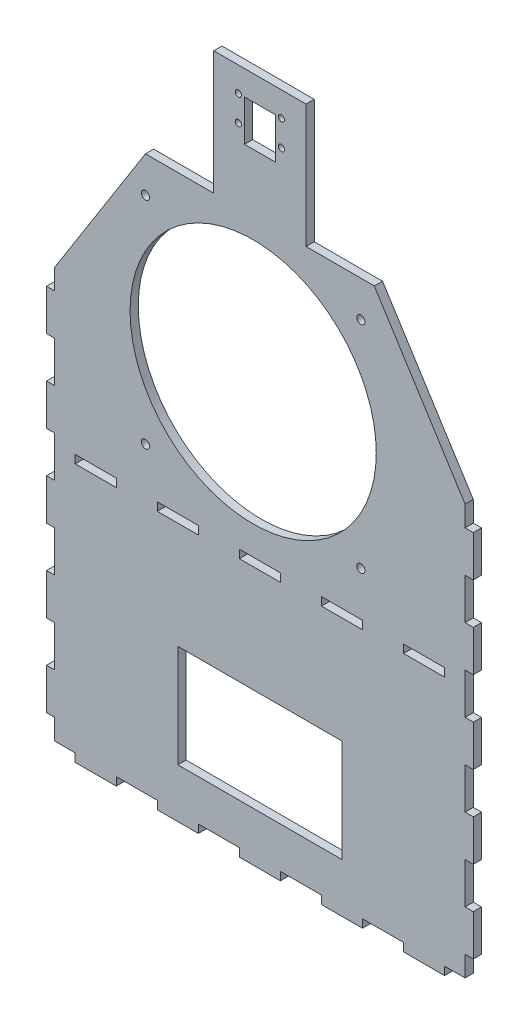
from build123d import *

# Parameters (mm, degrees)
SKICA1_W                = 80
SKICA1_H                = 50
SKICA1_W_2              = 20
SKICA1_H_2              = 4
SKICA1_R                = 2
SKICA1_R_2              = 60
SKICA1_R_3              = 1.5
SKICA1_W_3              = 15
SKICA1_H_3              = 20
P_IDAT_VYSUNUT_M1_DEPTH = 4


with BuildPart() as part:
    # Skica1 → Přidat vysunutím1 (new body)
    with BuildSketch(Plane.XY):
        Polygon((-122.598141023, -103.240049383), (-122.598141023, -113.240049383), (-112.598141023, -113.240049383), (-112.598141023, -117.240049383), (-92.598141023, -117.240049383), (-92.598141023, -113.240049383), (-72.598141023, -113.240049383), (-72.598141023, -117.240049383), (-52.598141023, -117.240049383), (-52.598141023, -113.240049383), (-32.598141023, -113.240049383), (-32.598141023, -117.240049383), (-12.598141023, -117.240049383), (-12.598141023, -113.240049383), (7.401858977, -113.240049383), (7.401858977, -117.240049383), (27.401858977, -117.240049383), (27.401858977, -113.240049383), (47.401858977, -113.240049383), (47.401858977, -117.240049383), (67.401858977, -117.240049383), (67.401858977, -113.240049383), (77.401858977, -113.240049383), (77.401858977, -103.240049383), (81.401858977, -103.240049383), (81.401858977, -83.240049383), (77.401858977, -83.240049383), (77.401858977, -63.240049383), (81.401858977, -63.240049383), (81.401858977, -43.240049383), (77.401858977, -43.240049383), (77.401858977, -23.240049383), (81.401858977, -23.240049383), (81.401858977, -3.240049383), (77.401858977, -3.240049383), (77.401858977, 16.759950617), (81.401858977, 16.759950617), (81.401858977, 36.759950617), (77.401858977, 36.759950617), (77.401858977, 56.759950617), (81.401858977, 56.759950617), (81.401858977, 76.759950617), (77.401858977, 76.759950617), (77.401858977, 86.759950617), (33.183586154, 156.759950617), (-0.098141023, 156.759950617), (-0.098141023, 216.89905968), (-45.098141023, 216.89905968), (-45.098141023, 156.759950617), (-78.379868199, 156.759950617), (-122.598141023, 86.759950617), (-122.598141023, 76.759950617), (-126.598141023, 76.759950617), (-126.598141023, 56.759950617), (-122.598141023, 56.759950617), (-122.598141023, 36.759950617), (-126.598141023, 36.759950617), (-126.598141023, 16.759950617), (-122.598141023, 16.759950617), (-122.598141023, -3.240049383), (-126.598141023, -3.240049383), (-126.598141023, -23.240049383), (-122.598141023, -23.240049383), (-122.598141023, -43.240049383), (-126.598141023, -43.240049383), (-126.598141023, -63.240049383), (-122.598141023, -63.240049383), (-122.598141023, -83.240049383), (-126.598141023, -83.240049383), (-126.598141023, -103.240049383), align=None)
        with Locations((-22.598141023, -68.240049383)):
            Rectangle(SKICA1_W, SKICA1_H, mode=Mode.SUBTRACT)
        with Locations((-102.598141023, 10.759950617)):
            Rectangle(SKICA1_W_2, SKICA1_H_2, mode=Mode.SUBTRACT)
        with Locations((-78.379868199, 34.259950617)):
            Circle(SKICA1_R, mode=Mode.SUBTRACT)
        with Locations((-62.598141023, 10.759950617)):
            Rectangle(SKICA1_W_2, SKICA1_H_2, mode=Mode.SUBTRACT)
        with Locations((-22.598141023, 10.759950617)):
            Rectangle(SKICA1_W_2, SKICA1_H_2, mode=Mode.SUBTRACT)
        with Locations((17.401858977, 10.759950617)):
            Rectangle(SKICA1_W_2, SKICA1_H_2, mode=Mode.SUBTRACT)
        with Locations((26.620131801, 34.259950617)):
            Circle(SKICA1_R, mode=Mode.SUBTRACT)
        with Locations((57.401858977, 10.759950617)):
            Rectangle(SKICA1_W_2, SKICA1_H_2, mode=Mode.SUBTRACT)
        with Locations((-25.879868199, 86.759950617)):
            Circle(SKICA1_R_2, mode=Mode.SUBTRACT)
        with Locations((-78.379868199, 139.259950617)):
            Circle(SKICA1_R, mode=Mode.SUBTRACT)
        with Locations((26.620131801, 139.259950617)):
            Circle(SKICA1_R, mode=Mode.SUBTRACT)
        with Locations((-12.098141023, 204.89905968)):
            Circle(SKICA1_R_3, mode=Mode.SUBTRACT)
        with Locations((-33.098141023, 192.39905968)):
            Circle(SKICA1_R_3, mode=Mode.SUBTRACT)
        with Locations((-33.098141023, 204.89905968)):
            Circle(SKICA1_R_3, mode=Mode.SUBTRACT)
        with Locations((-22.598141023, 194.89905968)):
            Rectangle(SKICA1_W_3, SKICA1_H_3, mode=Mode.SUBTRACT)
        with Locations((-12.098141023, 192.39905968)):
            Circle(SKICA1_R_3, mode=Mode.SUBTRACT)
    extrude(amount=P_IDAT_VYSUNUT_M1_DEPTH)


solid = part.part
